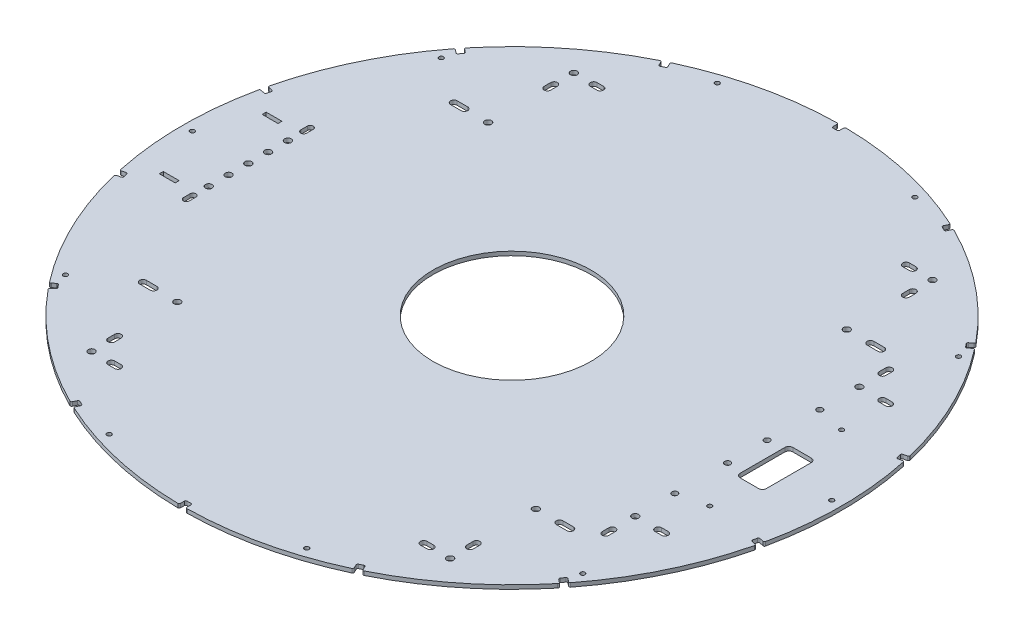
from build123d import *

# Parameters (mm, degrees)
SKETCH1_R                = 250
BOSS_EXTRUDE1_DEPTH      = 3
CUT_EXTRUDE5_DEPTH       = 4
FILLET1_R                = 1
CIRPATTERN1_COUNT        = 14
FILLET1_OF_CIRPATTERN1_R = 1
CUT_EXTRUDE14_DEPTH      = 14
SKETCH22_R               = 2.5
CUT_EXTRUDE16_DEPTH      = 14
CUT_EXTRUDE19_DEPTH      = 4
SKETCH28_R               = 2.5
CUT_EXTRUDE20_DEPTH      = 10
CUT_EXTRUDE21_DEPTH      = 10
SKETCH30_W               = 12
SKETCH30_H               = 3
CUT_EXTRUDE22_DEPTH      = 10
SKETCH31_R               = 2.5
CUT_EXTRUDE23_DEPTH      = 10
CUT_EXTRUDE24_DEPTH      = 10
SKETCH33_R               = 2.2
CUT_EXTRUDE25_DEPTH      = 10
CUT_EXTRUDE26_DEPTH      = 10
SKETCH35_R               = 1.7
CUT_EXTRUDE27_DEPTH      = 10
CIRPATTERN2_COUNT        = 10
SKETCH36_R               = 60
CUT_EXTRUDE28_DEPTH      = 10
SKETCH37_R               = 1.7
CUT_EXTRUDE29_DEPTH      = 3


with BuildPart() as part:
    # Sketch1 → Boss-Extrude1 (new body)
    with BuildSketch(Plane(origin=(0, 0, 0), x_dir=(1, 0, 0), z_dir=(0, 1, 0))):
        Circle(SKETCH1_R)
    extrude(amount=BOSS_EXTRUDE1_DEPTH)

    # Sketch11 → Cut-Extrude5 (cut)
    with BuildSketch(Plane(origin=(0, 3, 0), x_dir=(1, 0, 0), z_dir=(0, 1, 0))):
        with BuildLine():
            Line((1.5, 245), (-1.5, 245))
            ThreePointArc((-1.5, 245), (-2.207106781, 245.292893219), (-2.5, 246))
            Line((-2.5, 246), (-2.5, 255))
            Line((-2.5, 255), (2.5, 255))
            Line((2.5, 255), (2.5, 246))
            ThreePointArc((2.5, 246), (2.207106781, 245.292893219), (1.5, 245))
        make_face()
    cut_extrude5 = extrude(amount=-CUT_EXTRUDE5_DEPTH, mode=Mode.SUBTRACT)

    # Fillet1
    fillet1_edges = [part.edges().sort_by_distance(p)[0] for p in [
        (2.5, 1.5, -249.987499687),
        (-2.5, 1.5, -249.987499687),
    ]]
    fillet(fillet1_edges, radius=FILLET1_R)

    # CirPattern1: Cut-Extrude5 ×14 about axis
    cirpattern1_axis = Axis((0, 3, 0), (0, -1, 0))
    for i in range(1, CIRPATTERN1_COUNT):
        add(cut_extrude5.rotate(cirpattern1_axis, i * 360 / CIRPATTERN1_COUNT), mode=Mode.SUBTRACT)

    # Fillet1 of CirPattern1
    fillet1_of_cirpattern1_edges = [part.edges().sort_by_distance(p)[0] for p in [
        (110.717933267, 1.5, -224.146245235),
        (106.213088927, 1.5, -226.315663931),
        (197.006821984, 1.5, -153.910077941),
        (193.889372974, 1.5, -157.819235353),
        (244.276093477, 1.5, -53.190132127),
        (243.163488807, 1.5, -58.064771688),
        (243.163488807, 1.5, 58.064771688),
        (244.276093477, 1.5, 53.190132127),
        (193.889372974, 1.5, 157.819235353),
        (197.006821984, 1.5, 153.910077941),
        (106.213088927, 1.5, 226.315663931),
        (110.717933267, 1.5, 224.146245235),
        (-2.5, 1.5, 249.987499687),
        (2.5, 1.5, 249.987499687),
        (-110.717933267, 1.5, 224.146245235),
        (-106.213088927, 1.5, 226.315663931),
        (-197.006821984, 1.5, 153.910077941),
        (-193.889372974, 1.5, 157.819235353),
        (-244.276093477, 1.5, 53.190132127),
        (-243.163488807, 1.5, 58.064771688),
        (-243.163488807, 1.5, -58.064771688),
        (-244.276093477, 1.5, -53.190132127),
        (-193.889372974, 1.5, -157.819235353),
        (-197.006821984, 1.5, -153.910077941),
        (-106.213088927, 1.5, -226.315663931),
        (-110.717933267, 1.5, -224.146245235),
    ]]
    fillet(fillet1_of_cirpattern1_edges, radius=FILLET1_OF_CIRPATTERN1_R)

    # Sketch20 → Cut-Extrude14 (cut)
    with BuildSketch(Plane.XZ):
        with BuildLine():
            Line((-162, -115.4), (-154, -115.4))
            ThreePointArc((-154, -115.4), (-151.5, -117.9), (-154, -120.4))
            Line((-154, -120.4), (-162, -120.4))
            ThreePointArc((-162, -120.4), (-164.5, -117.9), (-162, -115.4))
        make_face()
        with BuildLine():
            Line((162, -115.4), (154, -115.4))
            ThreePointArc((154, -115.4), (151.5, -117.9), (154, -120.4))
            Line((154, -120.4), (162, -120.4))
            ThreePointArc((162, -120.4), (164.5, -117.9), (162, -115.4))
        make_face()
        with BuildLine():
            Line((162, 115.4), (154, 115.4))
            ThreePointArc((154, 115.4), (151.5, 117.9), (154, 120.4))
            Line((154, 120.4), (162, 120.4))
            ThreePointArc((162, 120.4), (164.5, 117.9), (162, 115.4))
        make_face()
        with BuildLine():
            Line((-162, 115.4), (-154, 115.4))
            ThreePointArc((-154, 115.4), (-151.5, 117.9), (-154, 120.4))
            Line((-154, 120.4), (-162, 120.4))
            ThreePointArc((-162, 120.4), (-164.5, 117.9), (-162, 115.4))
        make_face()
    extrude(amount=-CUT_EXTRUDE14_DEPTH, mode=Mode.SUBTRACT)

    # Sketch22 → Cut-Extrude16 (cut)
    with BuildSketch(Plane(origin=(0, 3, 0), x_dir=(1, 0, 0), z_dir=(0, 1, 0))):
        with Locations((-136, -117.9)):
            Circle(SKETCH22_R)
        with Locations((-136, 117.9)):
            Circle(SKETCH22_R)
        with Locations((136, 117.9)):
            Circle(SKETCH22_R)
        with Locations((136, -117.9)):
            Circle(SKETCH22_R)
        with Locations((-136, 182.9)):
            Circle(SKETCH22_R)
        with Locations((136, 182.9)):
            Circle(SKETCH22_R)
        with Locations((-136, -182.9)):
            Circle(SKETCH22_R)
        with Locations((136, -182.9)):
            Circle(SKETCH22_R)
    extrude(amount=-CUT_EXTRUDE16_DEPTH, mode=Mode.SUBTRACT)

    # Sketch26 → Cut-Extrude19 (cut)
    with BuildSketch(Plane(origin=(0, 3, 0), x_dir=(1, 0, 0), z_dir=(0, 1, 0))):
        with BuildLine():
            Line((-138.5, 162.9), (-138.5, 167.9))
            ThreePointArc((-138.5, 167.9), (-136, 170.4), (-133.5, 167.9))
            Line((-133.5, 167.9), (-133.5, 162.9))
            ThreePointArc((-133.5, 162.9), (-136, 160.4), (-138.5, 162.9))
        make_face()
        with BuildLine():
            Line((-116, 180.4), (-121, 180.4))
            ThreePointArc((-121, 180.4), (-123.5, 182.9), (-121, 185.4))
            Line((-121, 185.4), (-116, 185.4))
            ThreePointArc((-116, 185.4), (-113.5, 182.9), (-116, 180.4))
        make_face()
        with BuildLine():
            Line((116, 180.4), (121, 180.4))
            ThreePointArc((121, 180.4), (123.5, 182.9), (121, 185.4))
            Line((121, 185.4), (116, 185.4))
            ThreePointArc((116, 185.4), (113.5, 182.9), (116, 180.4))
        make_face()
        with BuildLine():
            Line((138.5, 162.9), (138.5, 167.9))
            ThreePointArc((138.5, 167.9), (136, 170.4), (133.5, 167.9))
            Line((133.5, 167.9), (133.5, 162.9))
            ThreePointArc((133.5, 162.9), (136, 160.4), (138.5, 162.9))
        make_face()
        with BuildLine():
            Line((116, -180.4), (121, -180.4))
            ThreePointArc((121, -180.4), (123.5, -182.9), (121, -185.4))
            Line((121, -185.4), (116, -185.4))
            ThreePointArc((116, -185.4), (113.5, -182.9), (116, -180.4))
        make_face()
        with BuildLine():
            Line((138.5, -162.9), (138.5, -167.9))
            ThreePointArc((138.5, -167.9), (136, -170.4), (133.5, -167.9))
            Line((133.5, -167.9), (133.5, -162.9))
            ThreePointArc((133.5, -162.9), (136, -160.4), (138.5, -162.9))
        make_face()
        with BuildLine():
            Line((-138.5, -162.9), (-138.5, -167.9))
            ThreePointArc((-138.5, -167.9), (-136, -170.4), (-133.5, -167.9))
            Line((-133.5, -167.9), (-133.5, -162.9))
            ThreePointArc((-133.5, -162.9), (-136, -160.4), (-138.5, -162.9))
        make_face()
        with BuildLine():
            Line((-116, -180.4), (-121, -180.4))
            ThreePointArc((-121, -180.4), (-123.5, -182.9), (-121, -185.4))
            Line((-121, -185.4), (-116, -185.4))
            ThreePointArc((-116, -185.4), (-113.5, -182.9), (-116, -180.4))
        make_face()
    extrude(amount=-CUT_EXTRUDE19_DEPTH, mode=Mode.SUBTRACT)

    # Sketch28 → Cut-Extrude20 (cut)
    with BuildSketch(Plane(origin=(0, 3, 0), x_dir=(1, 0, 0), z_dir=(0, 1, 0))):
        with Locations((-200, 0)):
            Circle(SKETCH28_R)
        with Locations((-200, -15)):
            Circle(SKETCH28_R)
        with Locations((-200, -30)):
            Circle(SKETCH28_R)
        with Locations((-200, 30)):
            Circle(SKETCH28_R)
        with Locations((-200, 15)):
            Circle(SKETCH28_R)
    extrude(amount=-CUT_EXTRUDE20_DEPTH, mode=Mode.SUBTRACT)

    # Sketch29 → Cut-Extrude21 (cut)
    with BuildSketch(Plane(origin=(0, 3, 0), x_dir=(1, 0, 0), z_dir=(0, 1, 0))):
        with BuildLine():
            Line((-202.2, 42), (-202.2, 47))
            ThreePointArc((-202.2, 47), (-200, 49.2), (-197.8, 47))
            Line((-197.8, 47), (-197.8, 42))
            ThreePointArc((-197.8, 42), (-200, 39.8), (-202.2, 42))
        make_face()
        with BuildLine():
            Line((-202.2, -42), (-202.2, -47))
            ThreePointArc((-202.2, -47), (-200, -49.2), (-197.8, -47))
            Line((-197.8, -47), (-197.8, -42))
            ThreePointArc((-197.8, -42), (-200, -39.8), (-202.2, -42))
        make_face()
    extrude(amount=-CUT_EXTRUDE21_DEPTH, mode=Mode.SUBTRACT)

    # Sketch30 → Cut-Extrude22 (cut)
    with BuildSketch(Plane(origin=(0, 3, 0), x_dir=(1, 0, 0), z_dir=(0, 1, 0))):
        with Locations((-221, 39)):
            Rectangle(SKETCH30_W, SKETCH30_H)
        with Locations((-221, -39)):
            Rectangle(SKETCH30_W, SKETCH30_H)
    extrude(amount=-CUT_EXTRUDE22_DEPTH, mode=Mode.SUBTRACT)

    # Sketch31 → Cut-Extrude23 (cut)
    with BuildSketch(Plane(origin=(0, 3, 0), x_dir=(1, 0, 0), z_dir=(0, 1, 0))):
        with Locations((178.5, 85)):
            Circle(SKETCH31_R)
        with Locations((178.5, -85)):
            Circle(SKETCH31_R)
    extrude(amount=-CUT_EXTRUDE23_DEPTH, mode=Mode.SUBTRACT)

    # Sketch32 → Cut-Extrude24 (cut)
    with BuildSketch(Plane(origin=(0, 3, 0), x_dir=(1, 0, 0), z_dir=(0, 1, 0))):
        with BuildLine():
            Line((181, 107.5), (181, 102.5))
            ThreePointArc((181, 102.5), (178.5, 100), (176, 102.5))
            Line((176, 102.5), (176, 107.5))
            ThreePointArc((176, 107.5), (178.5, 110), (181, 107.5))
        make_face()
        with BuildLine():
            Line((201, 82.5), (196, 82.5))
            ThreePointArc((196, 82.5), (193.5, 85), (196, 87.5))
            Line((196, 87.5), (201, 87.5))
            ThreePointArc((201, 87.5), (203.5, 85), (201, 82.5))
        make_face()
        with BuildLine():
            Line((201, -82.5), (196, -82.5))
            ThreePointArc((196, -82.5), (193.5, -85), (196, -87.5))
            Line((196, -87.5), (201, -87.5))
            ThreePointArc((201, -87.5), (203.5, -85), (201, -82.5))
        make_face()
        with BuildLine():
            Line((181, -107.5), (181, -102.5))
            ThreePointArc((181, -102.5), (178.5, -100), (176, -102.5))
            Line((176, -102.5), (176, -107.5))
            ThreePointArc((176, -107.5), (178.5, -110), (181, -107.5))
        make_face()
    extrude(amount=-CUT_EXTRUDE24_DEPTH, mode=Mode.SUBTRACT)

    # Sketch33 → Cut-Extrude25 (cut)
    with BuildSketch(Plane(origin=(0, 3, 0), x_dir=(1, 0, 0), z_dir=(0, 1, 0))):
        with Locations((178.5, 55)):
            Circle(SKETCH33_R)
        with Locations((178.5, 15)):
            Circle(SKETCH33_R)
        with Locations((178.5, -15)):
            Circle(SKETCH33_R)
        with Locations((178.5, -55)):
            Circle(SKETCH33_R)
    extrude(amount=-CUT_EXTRUDE25_DEPTH, mode=Mode.SUBTRACT)

    # Sketch34 → Cut-Extrude26 (cut)
    with BuildSketch(Plane(origin=(0, 3, 0), x_dir=(1, 0, 0), z_dir=(0, 1, 0))):
        with BuildLine():
            Line((207, -20), (193, -20))
            ThreePointArc((193, -20), (190.878679656, -19.121320344), (190, -17))
            Line((190, -17), (190, 17))
            ThreePointArc((190, 17), (190.878679656, 19.121320344), (193, 20))
            Line((193, 20), (207, 20))
            ThreePointArc((207, 20), (209.121320344, 19.121320344), (210, 17))
            Line((210, 17), (210, -17))
            ThreePointArc((210, -17), (209.121320344, -19.121320344), (207, -20))
        make_face()
    extrude(amount=-CUT_EXTRUDE26_DEPTH, mode=Mode.SUBTRACT)

    # Sketch35 → Cut-Extrude27 (cut)
    with BuildSketch(Plane(origin=(0, 3, 0), x_dir=(1, 0, 0), z_dir=(0, 1, 0))):
        with Locations((-242.5, 0)):
            Circle(SKETCH35_R)
    cut_extrude27 = extrude(amount=-CUT_EXTRUDE27_DEPTH, mode=Mode.SUBTRACT)

    # CirPattern2: Cut-Extrude27 ×10 about axis
    cirpattern2_axis = Axis((0, 3, 0), (0, 1, 0))
    for i in range(1, CIRPATTERN2_COUNT):
        add(cut_extrude27.rotate(cirpattern2_axis, i * 360 / CIRPATTERN2_COUNT), mode=Mode.SUBTRACT)

    # Sketch36 → Cut-Extrude28 (cut)
    with BuildSketch(Plane(origin=(0, 3, 0), x_dir=(1, 0, 0), z_dir=(0, 1, 0))):
        Circle(SKETCH36_R)
    extrude(amount=-CUT_EXTRUDE28_DEPTH, mode=Mode.SUBTRACT)

    # Sketch37 → Cut-Extrude29 (cut)
    with BuildSketch(Plane(origin=(0, 3, 0), x_dir=(1, 0, 0), z_dir=(0, 1, 0))):
        with Locations((200, 50)):
            Circle(SKETCH37_R)
        with Locations((200, -50)):
            Circle(SKETCH37_R)
    extrude(amount=-CUT_EXTRUDE29_DEPTH, mode=Mode.SUBTRACT)


solid = part.part
